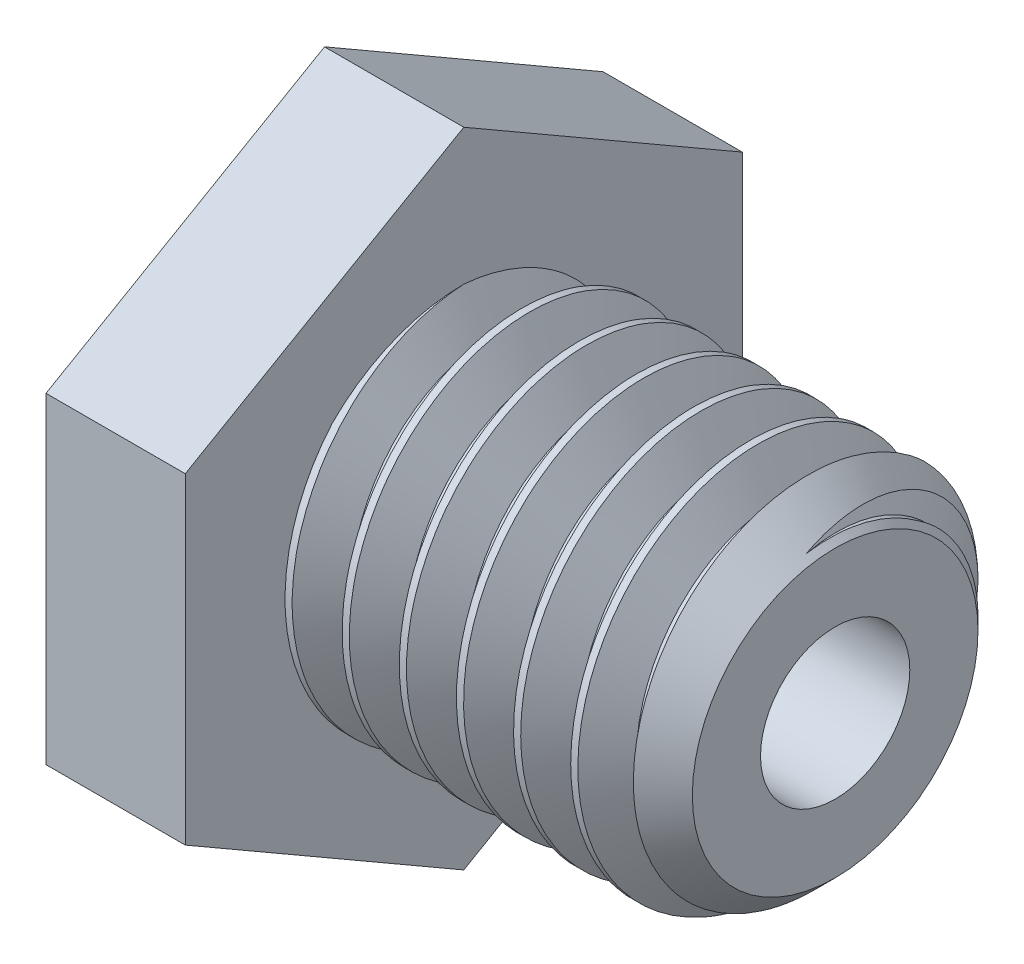
from build123d import *

# Parameters (mm, degrees)
SKETCH5_R               = 6.35
BOSS_EXTRUDE3_DEPTH     = 25.4
CHAMFER1_SIZE           = 1.465384615
CUT_SWEEP1_PITCH        = 1.953846154
BOSS_EXTRUDE4_DEPTH     = 10.31875
SKETCH8_OUTSIDE_W       = 167.334
SKETCH8_OUTSIDE_H       = 170.282
SKETCH8_OUTSIDE_R       = 9.525
CUT_EXTRUDE3_DEPTH      = 39.568409843
CUT_EXTRUDE3_DRAFT      = -60
CUT_EXTRUDE4_DEPTH      = 24.035850418
CUT_EXTRUDE4_DEPTH_BACK = 24.035850418
SKETCH12_W              = 17.807387049
SKETCH12_H              = 32.636746913
F_1_4_20_TAPPED_HOLE1_D = 5.1054


with BuildPart() as part:
    # Sketch5 → Boss-Extrude3 (new body)
    with BuildSketch(Plane(origin=(17.859375, 0, 0), x_dir=(0, 0, -1), z_dir=(1, 0, 0))):
        Circle(SKETCH5_R)
    extrude(amount=-BOSS_EXTRUDE3_DEPTH)

    # Chamfer1
    chamfer1_edges = [part.edges().sort_by_distance(p)[0] for p in [
        (17.859375, 0, 6.35),
    ]]
    chamfer(chamfer1_edges, length=CHAMFER1_SIZE)

    # Cut-Sweep1: the profile of Sketch10 profile screwed along a right-hand helix of 14 turns, 10 arcs to a turn; built about Z, then put on its axis
    cut_sweep1_z = Axis((0, 0, 0), (0, 0, 1))
    cut_sweep1_corners = [(6.3503, 0, 0.000173205), (5.080939697, 0, -0.732692308), (5.080939697, 0, -0.976923077), (6.3503, 0, -1.70978859)]
    with BuildLine(mode=Mode.PRIVATE) as cut_sweep1_profile:
        Line(cut_sweep1_corners[0], cut_sweep1_corners[1])
        Line(cut_sweep1_corners[1], cut_sweep1_corners[2])
        Line(cut_sweep1_corners[2], cut_sweep1_corners[3])
        Line(cut_sweep1_corners[3], cut_sweep1_corners[0])
    cut_sweep1_cap = Face(cut_sweep1_profile.wire())
    cut_sweep1_turn_angles = [0, 18, 36, 54, 72, 90, 108, 126, 144, 162, 180, 198, 216, 234, 252, 270, 288, 306, 324, 342, 360]
    cut_sweep1_turn_weights = [1, 0.9510565162951535, 1, 0.9510565162951535, 1, 0.9510565162951535, 1, 0.9510565162951535, 1, 0.9510565162951535, 1, 0.9510565162951535, 1, 0.9510565162951535, 1, 0.9510565162951535, 1, 0.9510565162951535, 1, 0.9510565162951535, 1]
    cut_sweep1_turn_rails = [Edge.make_bspline([Vector(p[0], p[1], 0).rotate(cut_sweep1_z, cut_sweep1_turn_angles[k]) / cut_sweep1_turn_weights[k] + Vector(0, 0, p[2] + CUT_SWEEP1_PITCH * cut_sweep1_turn_angles[k] / 360) for k in range(21)], [0, 0, 0, 1, 1, 2, 2, 3, 3, 4, 4, 5, 5, 6, 6, 7, 7, 8, 8, 9, 9, 10, 10, 10], 2, cut_sweep1_turn_weights) for p in cut_sweep1_corners]
    cut_sweep1_turn_sides = [Face.make_surface_from_curves(cut_sweep1_turn_rails[p[0]], cut_sweep1_turn_rails[p[1]]) for p in [(0, 1), (1, 2), (2, 3), (3, 0)]]
    cut_sweep1 = Plane(origin=(17.859375, 0, 0), x_dir=(0, 1, 0), z_dir=(-1, 0, 0)) * Solid(Shell([*[p.moved(Location((0, 0, CUT_SWEEP1_PITCH * i))) for i in range(14) for p in cut_sweep1_turn_sides], cut_sweep1_cap, cut_sweep1_cap.rotate(cut_sweep1_z, 5040).moved(Location((0, 0, CUT_SWEEP1_PITCH * 5040 / 360)))]))
    add(cut_sweep1, mode=Mode.SUBTRACT)

    # Sketch6 → Boss-Extrude4 (add)
    with BuildSketch(Plane.ZY.offset(7.540625)):
        Polygon((9.525, 5.499261314), (0, 10.998522628), (-9.525, 5.499261314), (-9.525, -5.499261314), (0, -10.998522628), (9.525, -5.499261314), align=None)
    extrude(amount=BOSS_EXTRUDE4_DEPTH)


with BuildPart() as cut_extrude3_tool:
    # Sketch8 outside → Cut-Extrude3 (with draft: the straight prism first)
    with BuildSketch(Plane.ZY.offset(17.859375)):
        Rectangle(SKETCH8_OUTSIDE_W, SKETCH8_OUTSIDE_H)
        Circle(SKETCH8_OUTSIDE_R, mode=Mode.SUBTRACT)
    extrude(amount=-CUT_EXTRUDE3_DEPTH)
    # Cut-Extrude3: the draft: its side faces are tilted about the plane it starts from
    cut_extrude3_sides = [cut_extrude3_tool.faces().sort_by_distance(p)[0] for p in [
        (1.924829921, -85.141, 0),
        (1.924829921, 0, 83.667),
        (1.924829921, 85.141, 0),
        (1.924829921, 0, -83.667),
        (1.924829921, 0, -9.525),
    ]]
    draft(cut_extrude3_sides, Plane.ZY.offset(17.859375), CUT_EXTRUDE3_DRAFT)


with BuildPart() as part_1:
    add(part.part)

    # Cut-Extrude3: cut by cut_extrude3_tool
    add(cut_extrude3_tool.part, mode=Mode.SUBTRACT)

    # Sketch11 → Cut-Revolve1 (revolve, cut)
    with BuildSketch(Plane.XY, mode=Mode.PRIVATE) as cut_revolve1_sk:
        Polygon((5.159375, 0), (5.159375, 4.884615385), (2.399597242, 7.644393143), (2.399597242, 8.926075271), (25.969098741, 8.926075271), (25.969098741, 0), align=None)
    revolve(cut_revolve1_sk.sketch.rotate(Axis((-1000, 0, 0), (1, 0, 0)), 90), axis=Axis((-1000, 0, 0), (1, 0, 0)), mode=Mode.SUBTRACT)

    # Sketch12 → Cut-Extrude4 (cut, two sides: drawn at the far end of the back side and taken through both)
    with BuildSketch(Plane.XY.offset(-CUT_EXTRUDE4_DEPTH_BACK)):
        with Locations((-21.206818525, 1.519401625)):
            Rectangle(SKETCH12_W, SKETCH12_H)
    extrude(amount=CUT_EXTRUDE4_DEPTH + CUT_EXTRUDE4_DEPTH_BACK, mode=Mode.SUBTRACT)

    # 1/4-20 Tapped Hole1 (through all)
    with Locations(Plane.ZY.offset(12.303125)):
        with Locations((0, 0)):
            Hole(F_1_4_20_TAPPED_HOLE1_D / 2)


solid = part_1.part
